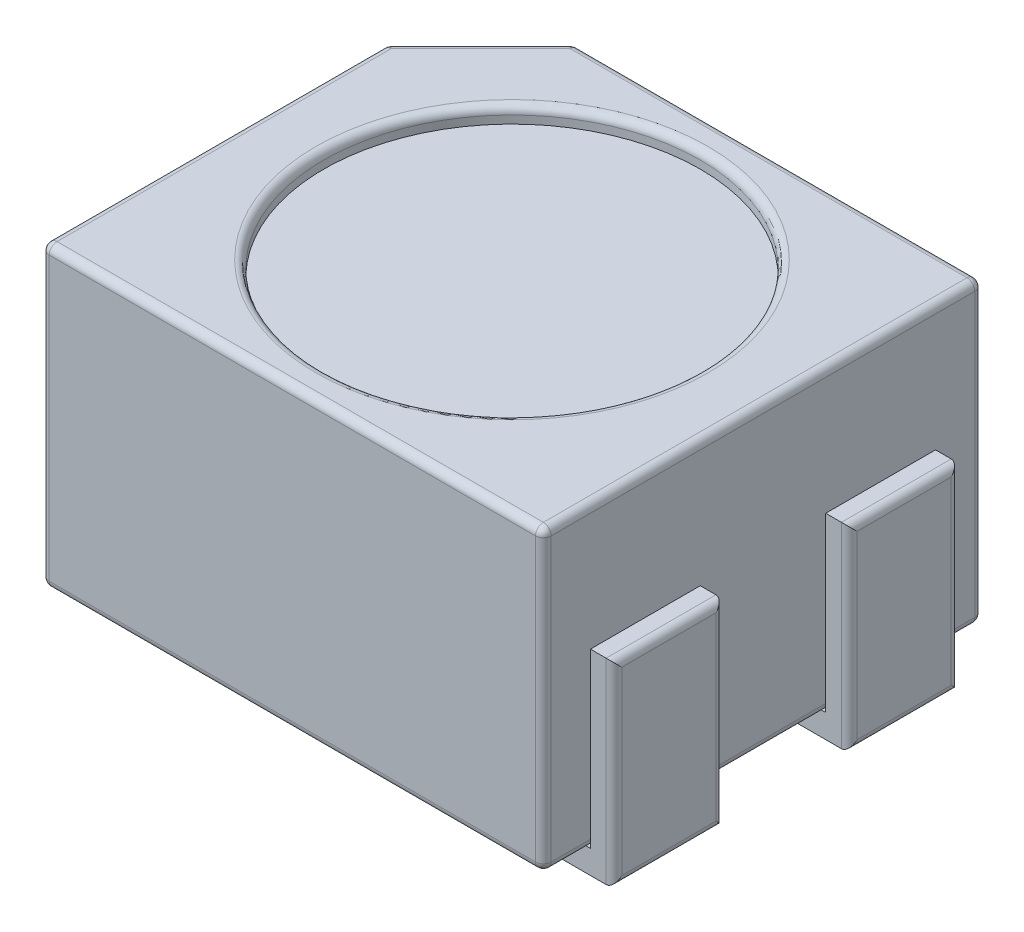
from build123d import *

# Parameters (mm, degrees)
SKETCH_1_W        = 3.2
SKETCH_1_H        = 2.8
EXTRUDE_1_DEPTH   = 1.9
SKETCH_2_W        = 0.9
SKETCH_2_H        = 0.7
EXTRUDE_2_DEPTH   = 0.15
EXTRUDE_2_2_DEPTH = 0.15
EXTRUDE_2_3_DEPTH = 0.15
EXTRUDE_2_4_DEPTH = 0.15
SKETCH_4_W        = 0.15
SKETCH_4_H        = 0.7
EXTRUDE_3_DEPTH   = 1.1
EXTRUDE_3_2_DEPTH = 1.1
EXTRUDE_3_3_DEPTH = 1.1
EXTRUDE_3_4_DEPTH = 1.1
EXTRUDE_START     = 0.1
SKETCH_5_R        = 1.2
EXTRUDE_4_DEPTH   = 1.1
EXTRUDE_START_2   = -0.1
SKETCH_5_2_R      = 1.2
EXTRUDE_5_DEPTH   = 0.9
EXTRUDE_6_DEPTH   = 0.6
FILLET_1_R        = 0.05
FILLET_2_R        = 0.05
FILLET_3_R        = 0.05
FILLET_4_R        = 0.05
FILLET_5_R        = 0.05


with BuildPart() as part:
    # Эскиз1 → Бобышка-Вытянуть1 (new body)
    with BuildSketch(Plane(origin=(0, 0.15, 0), x_dir=(1, 0, 0), z_dir=(0, 1, 0))):
        Rectangle(SKETCH_1_W, SKETCH_1_H)
    extrude(amount=EXTRUDE_1_DEPTH)


with BuildPart() as body_2:
    # Эскиз2 → Бобышка-Вытянуть2 (new body)
    with BuildSketch(Plane(origin=(0, 0, 0), x_dir=(1, 0, 0), z_dir=(0, 1, 0))):
        with Locations((-1.3, -0.75)):
            Rectangle(SKETCH_2_W, SKETCH_2_H)
    extrude(amount=EXTRUDE_2_DEPTH)


with BuildPart() as body_3:
    # Эскиз2 → Extrude 2 2 (new body)
    with BuildSketch(Plane(origin=(0, 0, 0), x_dir=(1, 0, 0), z_dir=(0, 1, 0))):
        with Locations((-1.3, 0.75)):
            Rectangle(SKETCH_2_W, SKETCH_2_H)
    extrude(amount=EXTRUDE_2_2_DEPTH)


with BuildPart() as body_4:
    # Эскиз2 → Extrude 2 3 (new body)
    with BuildSketch(Plane(origin=(0, 0, 0), x_dir=(1, 0, 0), z_dir=(0, 1, 0))):
        with Locations((1.3, -0.75)):
            Rectangle(SKETCH_2_W, SKETCH_2_H)
    extrude(amount=EXTRUDE_2_3_DEPTH)


with BuildPart() as body_5:
    # Эскиз2 → Extrude 2 4 (new body)
    with BuildSketch(Plane(origin=(0, 0, 0), x_dir=(1, 0, 0), z_dir=(0, 1, 0))):
        with Locations((1.3, 0.75)):
            Rectangle(SKETCH_2_W, SKETCH_2_H)
    extrude(amount=EXTRUDE_2_4_DEPTH)


with BuildPart() as body_6:
    # Эскиз4 → Бобышка-Вытянуть3 (new body)
    with BuildSketch(Plane(origin=(0, 0.15, 0), x_dir=(1, 0, 0), z_dir=(0, 1, 0))):
        with Locations((1.675, 0.75)):
            Rectangle(SKETCH_4_W, SKETCH_4_H)
    extrude(amount=EXTRUDE_3_DEPTH)

    # Combine 2: union body 5
    add(body_5.part)

    # Скругление4
    fillet_4_edges = [body_6.edges().sort_by_distance(p)[0] for p in [
        (1.75, 1.25, -0.75),
        (1.75, 0.625, -1.1),
        (1.75, 0, -0.75),
        (1.75, 0.625, -0.4),
    ]]
    fillet(fillet_4_edges, radius=FILLET_4_R)


with BuildPart() as body_7:
    # Эскиз4 → Extrude 3 2 (new body)
    with BuildSketch(Plane(origin=(0, 0.15, 0), x_dir=(1, 0, 0), z_dir=(0, 1, 0))):
        with Locations((1.675, -0.75)):
            Rectangle(SKETCH_4_W, SKETCH_4_H)
    extrude(amount=EXTRUDE_3_2_DEPTH)

    # Combine 1: union body 4
    add(body_4.part)

    # Скругление5
    fillet_5_edges = [body_7.edges().sort_by_distance(p)[0] for p in [
        (1.75, 1.25, 0.75),
        (1.75, 0.625, 0.4),
        (1.75, 0, 0.75),
        (1.75, 0.625, 1.1),
    ]]
    fillet(fillet_5_edges, radius=FILLET_5_R)


with BuildPart() as body_8:
    # Эскиз4 → Extrude 3 3 (new body)
    with BuildSketch(Plane(origin=(0, 0.15, 0), x_dir=(1, 0, 0), z_dir=(0, 1, 0))):
        with Locations((-1.675, -0.75)):
            Rectangle(SKETCH_4_W, SKETCH_4_H)
    extrude(amount=EXTRUDE_3_3_DEPTH)

    # Combine 3: union body 2
    add(body_2.part)

    # Скругление3
    fillet_3_edges = [body_8.edges().sort_by_distance(p)[0] for p in [
        (-1.75, 1.25, 0.75),
        (-1.75, 0.625, 1.1),
        (-1.75, 0, 0.75),
        (-1.75, 0.625, 0.4),
    ]]
    fillet(fillet_3_edges, radius=FILLET_3_R)


with BuildPart() as body_9:
    # Эскиз4 → Extrude 3 4 (new body)
    with BuildSketch(Plane(origin=(0, 0.15, 0), x_dir=(1, 0, 0), z_dir=(0, 1, 0))):
        with Locations((-1.675, 0.75)):
            Rectangle(SKETCH_4_W, SKETCH_4_H)
    extrude(amount=EXTRUDE_3_4_DEPTH)

    # Combine 4: union body 3
    add(body_3.part)

    # Скругление2
    fillet_2_edges = [body_9.edges().sort_by_distance(p)[0] for p in [
        (-1.75, 1.25, -0.75),
        (-1.75, 0.625, -0.4),
        (-1.75, 0, -0.75),
        (-1.75, 0.625, -1.1),
    ]]
    fillet(fillet_2_edges, radius=FILLET_2_R)


with BuildPart() as body_6_2:
    # Эскиз5 → Бобышка-Вытянуть4 (new body)
    with BuildSketch(Plane(origin=(0, 2.05, 0), x_dir=(1, 0, 0), z_dir=(0, 1, 0)).offset(EXTRUDE_START)):
        Circle(SKETCH_5_R)
    extrude(amount=-EXTRUDE_4_DEPTH)


with BuildPart() as part_1:
    add(part.part)

    # Combine 5: cut body 6 2
    add(body_6_2.part, mode=Mode.SUBTRACT)


with BuildPart() as body_6_3:
    # Эскиз5<2> → Бобышка-Вытянуть5 (new body)
    with BuildSketch(Plane(origin=(0, 2.05, 0), x_dir=(1, 0, 0), z_dir=(0, 1, 0)).offset(EXTRUDE_START_2)):
        Circle(SKETCH_5_2_R)
    extrude(amount=-EXTRUDE_5_DEPTH)


with BuildPart() as body_7_2:
    # Эскиз7 → Бобышка-Вытянуть6 (new body)
    with BuildSketch(Plane(origin=(0, 2.05, 0), x_dir=(1, 0, 0), z_dir=(0, 1, 0))):
        Polygon((-1.6, 1.4), (-1, 1.4), (-1.6, 0.8), align=None)
    extrude(amount=-EXTRUDE_6_DEPTH)


with BuildPart() as part_2:
    add(part_1.part)

    # Combine 6: cut body 7 2
    add(body_7_2.part, mode=Mode.SUBTRACT)

    # Скругление1
    fillet_1_edges = [part_2.edges().sort_by_distance(p)[0] for p in [
        (-1.3, 1.45, -1.1),
    ]]
    fillet(fillet_1_edges, radius=FILLET_1_R)
    fillet_1_2_edges = [part_2.edges().sort_by_distance(p)[0] for p in [
        (0, 0.15, -1.4),
        (1.6, 1.1, -1.4),
        (1.6, 0.15, 0),
        (1.6, 1.1, 1.4),
        (0, 0.15, 1.4),
        (-1.6, 1.1, 1.4),
        (-1.6, 0.15, 0),
        (-1.6, 0.8, -1.4),
        (1.6, 2.05, 0),
        (0, 2.05, 1.4),
        (-1.6, 2.05, 0.3),
        (-1.3, 2.05, -1.1),
        (0.3, 2.05, -1.4),
        (-1.2, 2.05, 0),
    ]]
    fillet(fillet_1_2_edges, radius=FILLET_1_R)
    fillet_1_3_edges = [part_2.edges().sort_by_distance(p)[0] for p in [
        (-1, 1.75, -1.4),
        (-1.6, 1.75, -0.8),
        (-1.310355339, 1.45, -1.4),
        (-1.6, 1.45, -1.110355339),
        (-1.6, 1.464644661, -0.820710678),
        (-1.585355339, 1.45, -1.385355339),
        (-1.020710678, 1.464644661, -1.4),
        (-1.585355339, 2.035355339, -0.793933983),
        (-0.993933983, 2.035355339, -1.385355339),
    ]]
    fillet(fillet_1_3_edges, radius=FILLET_1_R)


solid = Compound([body_6.part, body_7.part, body_8.part, body_9.part, body_6_3.part, part_2.part])
